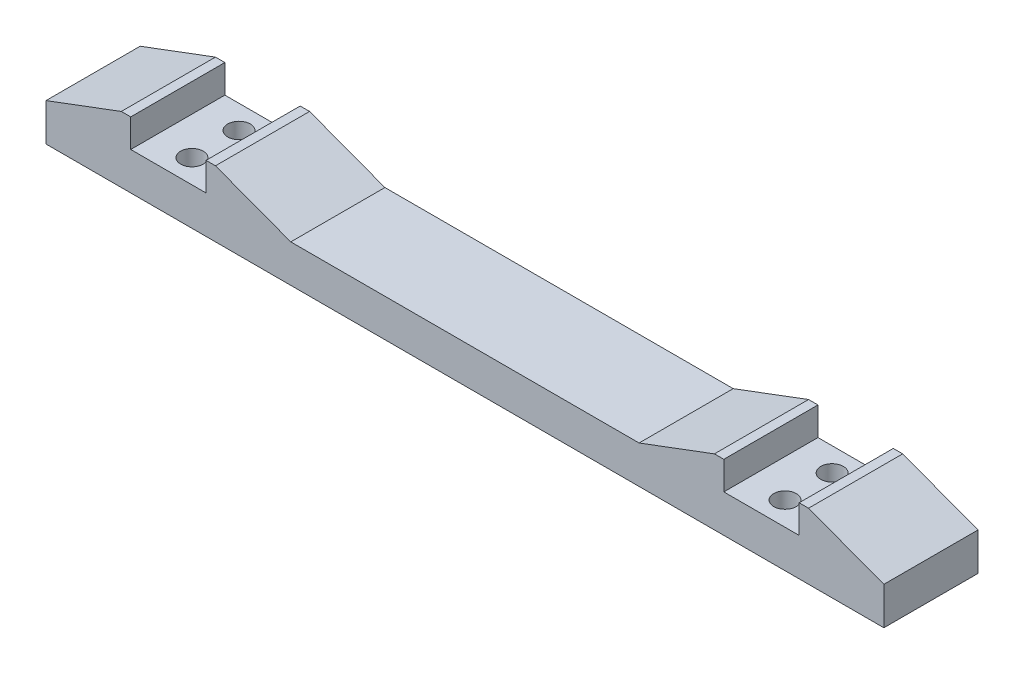
from build123d import *

# Parameters (mm, degrees)
EXTRUDE_1_DEPTH     = 2.5
SKETCH_5_R          = 0.6
CUT_EXTRUDE_1_DEPTH = 19.036421485
CUT_EXTRUDE_START   = -2
SKETCH_5_3_R        = 1
CUT_EXTRUDE_2_DEPTH = 1


with BuildPart() as part:
    # 草图4 → 凸台-拉伸1 (new body)
    with BuildSketch(Plane.XY):
        Polygon((8.5, -1.5), (17.75, -1.5), (17.75, -3.5), (-4.5, -3.5), (-4.5, -1.5), (-0.5, 0), (0, 0), (0, -1.5), (4, -1.5), (4, 0), (4.5, 0), align=None)
    extrude(amount=EXTRUDE_1_DEPTH)

    # 草图5 → 切除-拉伸1 (cut, through all)
    with BuildSketch(Plane(origin=(0, -1.5, 0), x_dir=(1, 0, 0), z_dir=(0, 1, 0))):
        with Locations(Location((2, -1.25, 0), (0, 0, 270))):
            Circle(SKETCH_5_R)
    extrude(amount=-CUT_EXTRUDE_1_DEPTH, mode=Mode.SUBTRACT)

    # 草图5<3> → 切除-拉伸2 (cut)
    with BuildSketch(Plane(origin=(0, -1.5, 0), x_dir=(1, 0, 0), z_dir=(0, 1, 0)).offset(CUT_EXTRUDE_START)):
        with Locations((2, -1.25)):
            Circle(SKETCH_5_3_R)
    extrude(amount=CUT_EXTRUDE_2_DEPTH, mode=Mode.SUBTRACT)

    # 镜向1: part across plane


with BuildPart() as part_1:
    add(part.part)
    add(part.part.mirror(Plane.XY.offset(2.5)))

    # 镜向2: part across plane


with BuildPart() as part_2:
    add(part_1.part)
    add(part_1.part.mirror(Plane(origin=(17.75, 0, 2.5), x_dir=(0, 0, 1), z_dir=(1, 0, 0))))


solid = part_2.part
